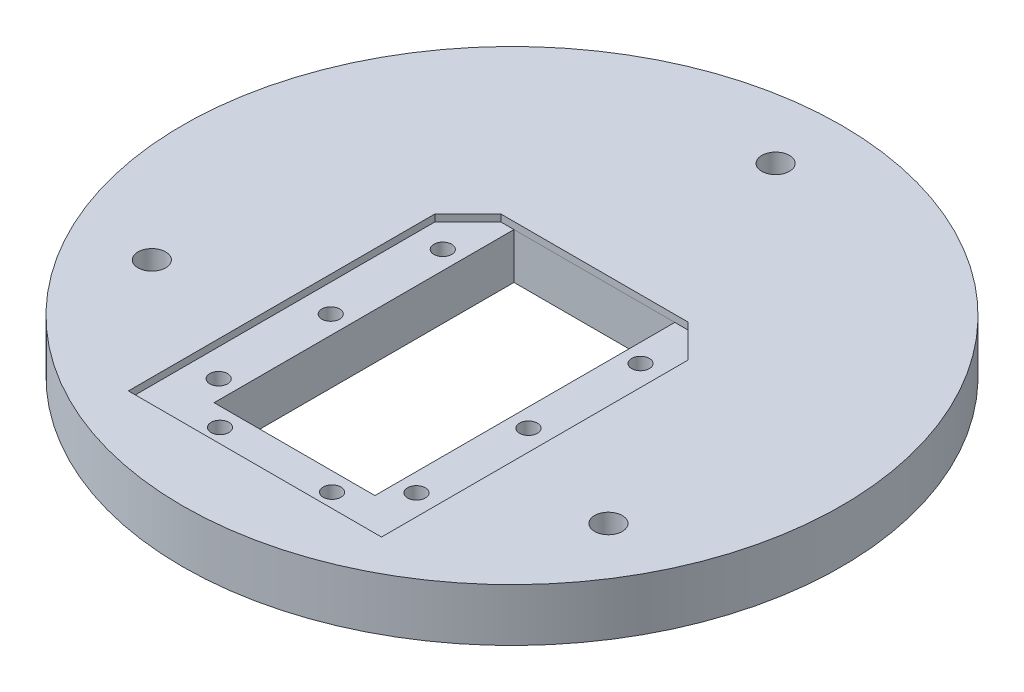
from build123d import *

# Parameters (mm, degrees)
SKETCH1_R           = 60
SKETCH1_R_2         = 1.35
SKETCH1_R_3         = 4
BOSS_EXTRUDE1_DEPTH = 10
CUT_EXTRUDE1_DEPTH  = 8
SKETCH6_R           = 60
SKETCH6_W           = 38.400000003
SKETCH6_H           = 51.500000005
BOSS_EXTRUDE2_DEPTH = 8
CHAMFER1_SIZE       = 5
CUT_EXTRUDE6_DEPTH  = 87.34813258
SKETCH13_W          = 159.365981606
SKETCH13_H          = 138.277350875
CUT_EXTRUDE7_DEPTH  = 6.95
SKETCH14_R          = 2.1
CUT_EXTRUDE8_DEPTH  = 86.569284793
SKETCH15_R          = 4
CUT_EXTRUDE9_DEPTH  = 7.05
SKETCH16_W          = 157.574812473
SKETCH16_H          = 128.039677695
CUT_EXTRUDE10_DEPTH = 3.05
SKETCH17_R          = 100
SKETCH17_R_2        = 50
CUT_EXTRUDE11_DEPTH = 86.229103011
SKETCH18_R          = 2.25
CUT_EXTRUDE12_DEPTH = 2.5
LPATTERN1_COUNT     = 3
LPATTERN1_PITCH     = 17
SKETCH19_R          = 2.25
CUT_EXTRUDE13_DEPTH = 2.5
SKETCH20_R          = 2.25
CUT_EXTRUDE14_DEPTH = 2.5
SKETCH21_R          = 2.25
CUT_EXTRUDE15_DEPTH = 2.5
LPATTERN2_COUNT     = 3
LPATTERN2_PITCH     = 17


with BuildPart() as part:
    # Sketch1 → Boss-Extrude1 (new body)
    with BuildSketch(Plane(origin=(0, 0, 0), x_dir=(1, 0, 0), z_dir=(0, 1, 0))):
        Circle(SKETCH1_R)
        with Locations((-15, 4.5)):
            Circle(SKETCH1_R_2, mode=Mode.SUBTRACT)
        with Locations((-15, -12.5)):
            Circle(SKETCH1_R_2, mode=Mode.SUBTRACT)
        with Locations((-15, -29.5)):
            Circle(SKETCH1_R_2, mode=Mode.SUBTRACT)
        with Locations((-8.5, -35.8)):
            Circle(SKETCH1_R_2, mode=Mode.SUBTRACT)
        with Locations((8.5, -35.8)):
            Circle(SKETCH1_R_2, mode=Mode.SUBTRACT)
        with Locations((15, -29.5)):
            Circle(SKETCH1_R_2, mode=Mode.SUBTRACT)
        with Locations((15, -12.5)):
            Circle(SKETCH1_R_2, mode=Mode.SUBTRACT)
        with Locations((15, 4.5)):
            Circle(SKETCH1_R_2, mode=Mode.SUBTRACT)
        Circle(SKETCH1_R_3, mode=Mode.SUBTRACT)
    extrude(amount=BOSS_EXTRUDE1_DEPTH)

    # Sketch2 → Cut-Extrude1 (cut)
    with BuildSketch(Plane(origin=(0, 10, 0), x_dir=(1, 0, 0), z_dir=(0, 1, 0))):
        Polygon((-12.199837774, 12.50015833), (-12.200428272, -32.999841666), (12.199571726, -33.000158329), (12.200162224, 12.499841668), align=None)
    extrude(amount=-CUT_EXTRUDE1_DEPTH, mode=Mode.SUBTRACT)

    # Sketch6 → Boss-Extrude2 (add)
    with BuildSketch(Plane(origin=(0, 10, 0), x_dir=(1, 0, 0), z_dir=(0, 1, 0))):
        Circle(SKETCH6_R)
        with Locations((0.000162221, -13.25024918)):
            Rectangle(SKETCH6_W, SKETCH6_H, mode=Mode.SUBTRACT)
    extrude(amount=BOSS_EXTRUDE2_DEPTH)

    # Chamfer1
    chamfer1_edges = [part.edges().sort_by_distance(p)[0] for p in [
        (-19.19983778, 14, -12.499750822),
        (19.200162223, 14, -12.499750822),
    ]]
    chamfer(chamfer1_edges, length=CHAMFER1_SIZE)

    # Sketch12 → Cut-Extrude6 (cut, through all)
    with BuildSketch(Plane(origin=(0, 2, 0), x_dir=(1, 0, 0), z_dir=(0, 1, 0))):
        Polygon((12.200162224, 12.499841668), (-12.199837774, 12.50015833), (-12.200428272, -32.999841666), (12.199571726, -33.000158329), align=None)
    extrude(amount=-CUT_EXTRUDE6_DEPTH, mode=Mode.SUBTRACT)

    # Sketch13 → Cut-Extrude7 (cut)
    with BuildSketch(Plane(origin=(0, 18, 0), x_dir=(1, 0, 0), z_dir=(0, 1, 0))):
        with Locations((-0.934306425, -1.920871548)):
            Rectangle(SKETCH13_W, SKETCH13_H)
    extrude(amount=-CUT_EXTRUDE7_DEPTH, mode=Mode.SUBTRACT)

    # Sketch14 → Cut-Extrude8 (cut, through all)
    with BuildSketch(Plane.XZ):
        with Locations((-34.640259625, 20.004835303)):
            Circle(SKETCH14_R)
        with Locations((34.63707466, 20.003132998)):
            Circle(SKETCH14_R)
        with Locations((0.001, -39.995774325)):
            Circle(SKETCH14_R)
    extrude(amount=-CUT_EXTRUDE8_DEPTH, mode=Mode.SUBTRACT)

    # Sketch15 → Cut-Extrude9 (cut)
    with BuildSketch(Plane.XZ):
        with Locations((34.63707466, 20.003132998)):
            Circle(SKETCH15_R)
        with Locations((-34.640259625, 20.004835303)):
            Circle(SKETCH15_R)
        with Locations((0.001, -39.995774325)):
            Circle(SKETCH15_R)
    extrude(amount=-CUT_EXTRUDE9_DEPTH, mode=Mode.SUBTRACT)

    # Sketch16 → Cut-Extrude10 (cut)
    with BuildSketch(Plane.XZ):
        with Locations((0.243421441, -1.785090563)):
            Rectangle(SKETCH16_W, SKETCH16_H)
    extrude(amount=-CUT_EXTRUDE10_DEPTH, mode=Mode.SUBTRACT)

    # Sketch17 → Cut-Extrude11 (cut, through all)
    with BuildSketch(Plane(origin=(0, 11.05, 0), x_dir=(1, 0, 0), z_dir=(0, 1, 0))):
        Circle(SKETCH17_R)
        Circle(SKETCH17_R_2, mode=Mode.SUBTRACT)
    extrude(amount=-CUT_EXTRUDE11_DEPTH, mode=Mode.SUBTRACT)

    # Sketch18 → Cut-Extrude12 (cut)
    with BuildSketch(Plane.XZ.offset(-3.05)):
        with Locations((15, 29.5)):
            Circle(SKETCH18_R)
    cut_extrude12 = extrude(amount=-CUT_EXTRUDE12_DEPTH, mode=Mode.SUBTRACT)

    # LPattern1: Cut-Extrude12 ×3
    with Locations(*[(0, 0, -i * LPATTERN1_PITCH) for i in range(1, LPATTERN1_COUNT)]):
        add(cut_extrude12, mode=Mode.SUBTRACT)

    # Sketch19 → Cut-Extrude13 (cut)
    with BuildSketch(Plane.XZ.offset(-3.05)):
        with Locations((8.5, 35.8)):
            Circle(SKETCH19_R)
    extrude(amount=-CUT_EXTRUDE13_DEPTH, mode=Mode.SUBTRACT)

    # Sketch20 → Cut-Extrude14 (cut)
    with BuildSketch(Plane.XZ.offset(-3.05)):
        with Locations((-8.5, 35.8)):
            Circle(SKETCH20_R)
    extrude(amount=-CUT_EXTRUDE14_DEPTH, mode=Mode.SUBTRACT)

    # Sketch21 → Cut-Extrude15 (cut)
    with BuildSketch(Plane.XZ.offset(-3.05)):
        with Locations((-15, 29.5)):
            Circle(SKETCH21_R)
    cut_extrude15 = extrude(amount=-CUT_EXTRUDE15_DEPTH, mode=Mode.SUBTRACT)

    # LPattern2: Cut-Extrude15 ×3
    with Locations(*[(0, 0, -i * LPATTERN2_PITCH) for i in range(1, LPATTERN2_COUNT)]):
        add(cut_extrude15, mode=Mode.SUBTRACT)


solid = part.part
